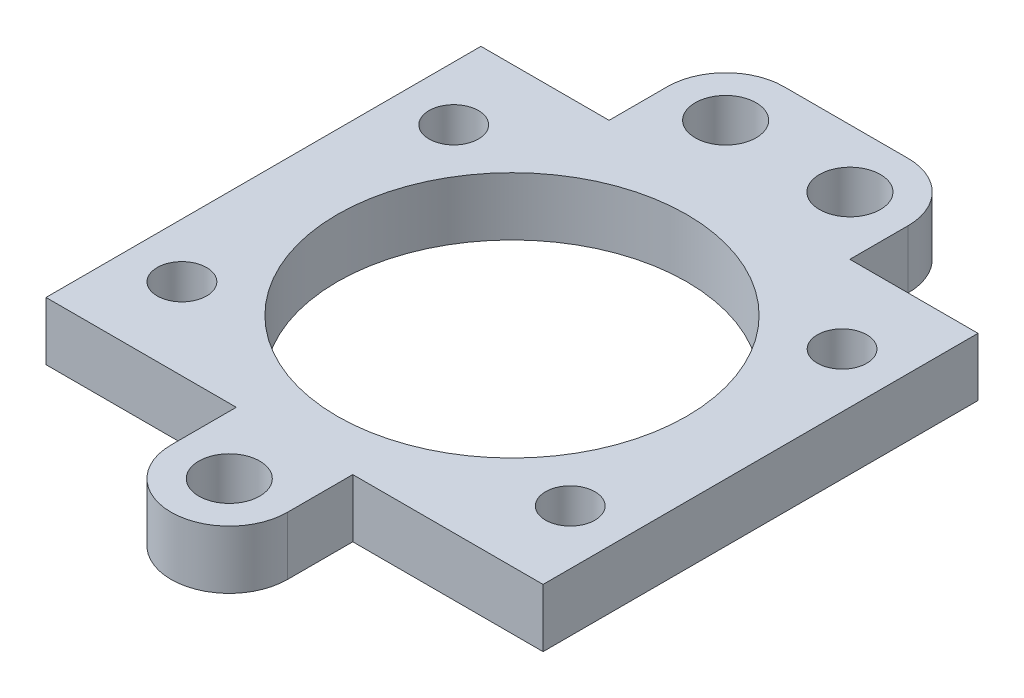
from build123d import *

# Parameters (mm, degrees)
SKETCH1_R              = 44.45
SKETCH1_R_2            = 6.35
BOSS_EXTRUDE1_DEPTH    = 3.175
SKETCH3_R              = 44.45
SKETCH3_R_2            = 27.94
CUT_EXTRUDE2_DEPTH     = 64.181702256
SKETCH7_R              = 2.4892
CUT_EXTRUDE6_DEPTH     = 41.020116192
SKETCH8_R              = 2.0193
CUT_EXTRUDE7_DEPTH     = 41.020116192
CUT_EXTRUDE8_START     = -1.5875
SKETCH9_R              = 27.94
CUT_EXTRUDE8_DEPTH     = 1.5875
CUT_EXTRUDE9_START     = -4.7625
CUT_EXTRUDE9_OUTLINE_R = 27.94
CUT_EXTRUDE9_DEPTH     = 4.7625
SKETCH11_R             = 14.2875
CUT_EXTRUDE10_DEPTH    = 35.823599161


# Read off the part's stored shape, not the designer's step: Cut-Extrude9
with BuildPart() as part:
    # Sketch1 → Boss-Extrude1 (new, symmetric)
    with BuildSketch(Plane(origin=(0, 0, 0), x_dir=(1, 0, 0), z_dir=(0, 1, 0))):
        with Locations(Location((0, 0, 0), (0, 0, 270))):
            Circle(SKETCH1_R)
        with Locations(Location((0, 0, 0), (0, 0, 270))):
            Circle(SKETCH1_R_2, mode=Mode.SUBTRACT)
    extrude(amount=BOSS_EXTRUDE1_DEPTH, both=True)

    # Sketch3 → Cut-Extrude2 (cut, through all)
    with BuildSketch(Plane(origin=(0, 3.175, 0), x_dir=(1, 0, 0), z_dir=(0, 1, 0))):
        Circle(SKETCH3_R)
        with Locations(Location((0, 0, 0), (0, 0, 270))):
            Circle(SKETCH3_R_2, mode=Mode.SUBTRACT)
    extrude(amount=-CUT_EXTRUDE2_DEPTH, mode=Mode.SUBTRACT)

    # Sketch7 → Cut-Extrude6 (cut, through all)
    with BuildSketch(Plane(origin=(0, 3.175, 0), x_dir=(1, 0, 0), z_dir=(0, 1, 0))):
        with Locations(Location((0, -23.114, 0), (0, 0, 270))):
            Circle(SKETCH7_R)
        with Locations(Location((-5.08, 22.548849106, 0), (0, 0, 270))):
            Circle(SKETCH7_R)
        with Locations(Location((5.08, 22.548849106, 0), (0, 0, 270))):
            Circle(SKETCH7_R)
    extrude(amount=-CUT_EXTRUDE6_DEPTH, mode=Mode.SUBTRACT)

    # Sketch8 → Cut-Extrude7 (cut, through all)
    with BuildSketch(Plane.XZ.offset(3.175)):
        with Locations(Location((-15.875, 11.1125, 0), (0, 0, 270))):
            Circle(SKETCH8_R)
        with Locations(Location((15.875, 11.1125, 0), (0, 0, 270))):
            Circle(SKETCH8_R)
        with Locations(Location((15.875, -11.1125, 0), (0, 0, 270))):
            Circle(SKETCH8_R)
        with Locations(Location((-15.875, -11.1125, 0), (0, 0, 270))):
            Circle(SKETCH8_R)
    extrude(amount=-CUT_EXTRUDE7_DEPTH, mode=Mode.SUBTRACT)

    # Sketch9 → Cut-Extrude8 (cut)
    with BuildSketch(Plane.XZ.offset(3.175).offset(CUT_EXTRUDE8_START)):
        with Locations(Location((0, 0, 0), (0, 0, 90))):
            Circle(SKETCH9_R)
    extrude(amount=CUT_EXTRUDE8_DEPTH, mode=Mode.SUBTRACT)

    # Cut-Extrude9 outline → Cut-Extrude9 (cut)
    with BuildSketch(Plane.XZ.offset(1.5875).offset(CUT_EXTRUDE9_START)):
        Circle(CUT_EXTRUDE9_OUTLINE_R)
        with BuildLine():
            Line((-20.32, 17.78), (-4.7625, 17.78))
            Line((-4.7625, 17.78), (-4.7625, 23.114))
            ThreePointArc((-4.7625, 23.114), (0, 27.8765), (4.7625, 23.114))
            Line((4.7625, 23.114), (4.7625, 17.78))
            Line((4.7625, 17.78), (20.32, 17.78))
            Line((20.32, 17.78), (20.32, -17.78))
            Line((20.32, -17.78), (9.8425, -17.78))
            Line((9.8425, -17.78), (9.8425, -22.548849106))
            ThreePointArc((9.8425, -22.548849106), (8.447596045, -25.916445151), (5.08, -27.311349106))
            Line((5.08, -27.311349106), (-5.08, -27.311349106))
            ThreePointArc((-5.08, -27.311349106), (-8.447596045, -25.916445151), (-9.8425, -22.548849106))
            Line((-9.8425, -22.548849106), (-9.8425, -17.78))
            Line((-9.8425, -17.78), (-20.32, -17.78))
            Line((-20.32, -17.78), (-20.32, 17.78))
        make_face(mode=Mode.SUBTRACT)
    extrude(amount=CUT_EXTRUDE9_DEPTH, mode=Mode.SUBTRACT)

    # Sketch11 → Cut-Extrude10 (cut, through all)
    with BuildSketch(Plane.XZ.offset(1.5875)):
        with Locations(Location((0, 0, 0), (0, 0, 270))):
            Circle(SKETCH11_R)
    extrude(amount=-CUT_EXTRUDE10_DEPTH, mode=Mode.SUBTRACT)


solid = part.part
